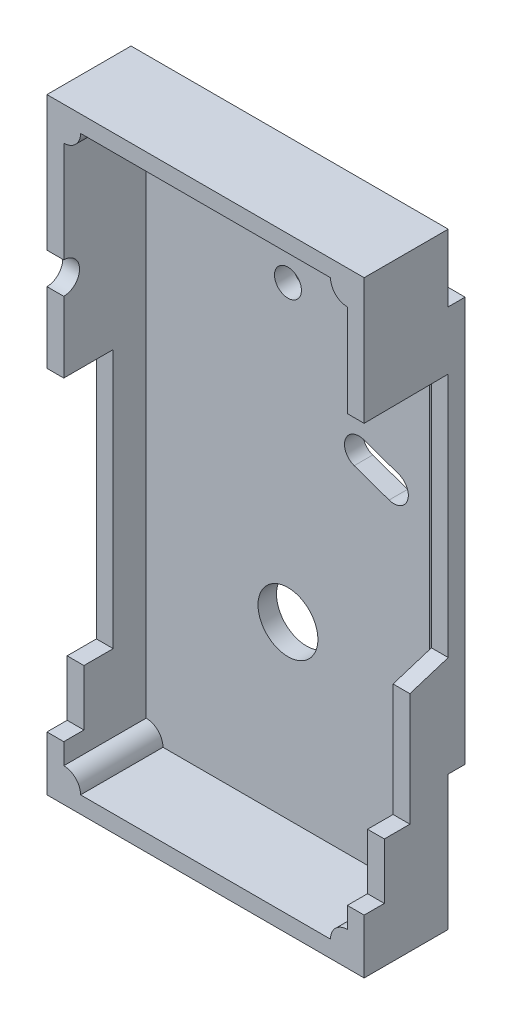
from build123d import *

# Parameters (mm, degrees)
SKETCH2_W                  = 23.9522
SKETCH2_H                  = 45.7962
SKETCH2_R                  = 2.2606
SKETCH2_R_2                = 1.016
BOSS_EXTRUDE1_DEPTH        = 6.35
SKETCH4_W                  = 21.4122
SKETCH4_H                  = 43.2562
CUT_EXTRUDE1_DEPTH         = 6.223
CUT_EXTRUDE3_DEPTH         = 2.54
CUT_EXTRUDE5_DEPTH         = 1.27
BOSS_EXTRUDE3_DEPTH        = 6.223
BOSS_EXTRUDE15_OUTLINE_W   = 23.9522
BOSS_EXTRUDE15_OUTLINE_H   = 30.5562
BOSS_EXTRUDE15_OUTLINE_R   = 2.2606
BOSS_EXTRUDE15_OUTLINE_R_2 = 1.016
BOSS_EXTRUDE15_DEPTH       = 1.27
SKETCH14_R                 = 1.190625
CUT_EXTRUDE6_DEPTH         = 1.27


# Read off the part's stored shape, not the designer's step: Boss-Extrude15
with BuildPart() as part:
    # Sketch2 → Boss-Extrude1 (new body)
    with BuildSketch(Plane.XY):
        Rectangle(SKETCH2_W, SKETCH2_H)
        with Locations((0, -8.7249)):
            Circle(SKETCH2_R, mode=Mode.SUBTRACT)
        with Locations((0, 13.4747)):
            Circle(SKETCH2_R_2, mode=Mode.SUBTRACT)
        with BuildLine():
            Line((8.361518313, 5.139100055), (5.725634689, 6.065681687))
            ThreePointArc((5.725634689, 6.065681687), (4.333034634, 5.3975), (5.001216321, 4.004899945))
            Line((5.001216321, 4.004899945), (7.637099945, 3.078318313))
            ThreePointArc((7.637099945, 3.078318313), (9.0297, 3.7465), (8.361518313, 5.139100055))
        make_face(mode=Mode.SUBTRACT)
    extrude(amount=BOSS_EXTRUDE1_DEPTH)

    # Sketch4 → Cut-Extrude1 (cut)
    with BuildSketch(Plane.XY.offset(6.35)):
        Rectangle(SKETCH4_W, SKETCH4_H)
    extrude(amount=-CUT_EXTRUDE1_DEPTH, mode=Mode.SUBTRACT)

    # Sketch6 → Cut-Extrude3 (cut)
    with BuildSketch(Plane.ZY.offset(11.9761)):
        Polygon((4.826, -14.5669), (2.6162, -14.5669), (2.6162, 4.9911), (6.35, 4.9911), (6.35, -18.7833), (4.826, -18.7833), align=None)
    extrude(amount=-CUT_EXTRUDE3_DEPTH, mode=Mode.SUBTRACT)

    # Sketch8 → Cut-Extrude5 (cut)
    with BuildSketch(Plane(origin=(11.9761, 0, 0), x_dir=(0, 0, -1), z_dir=(1, 0, 0))):
        Polygon((-6.35, -18.7833), (-4.826, -18.7833), (-4.826, -14.5669), (-2.8956, -14.5669), (-2.8956, -6.0325), (0, -5.1181), (0, 13.4239), (-6.35, 13.3731), align=None)
    extrude(amount=-CUT_EXTRUDE5_DEPTH, mode=Mode.SUBTRACT)

    # Sketch10 → Boss-Extrude3 (add)
    with BuildSketch(Plane.XY.offset(0.127)):
        with BuildLine():
            ThreePointArc((-10.7061, 20.3581), (-9.808074388, 20.730074388), (-9.4361, 21.6281))
            Line((-9.4361, 21.6281), (-10.7061, 21.6281))
            Line((-10.7061, 21.6281), (-10.7061, 20.3581))
        make_face()
        with BuildLine():
            ThreePointArc((9.4361, 21.6281), (9.808074388, 20.730074388), (10.7061, 20.3581))
            Line((10.7061, 20.3581), (10.7061, 21.6281))
            Line((10.7061, 21.6281), (9.4361, 21.6281))
        make_face()
        with BuildLine():
            ThreePointArc((-9.4361, -21.6281), (-9.808074388, -20.730074388), (-10.7061, -20.3581))
            Line((-10.7061, -20.3581), (-10.7061, -21.6281))
            Line((-10.7061, -21.6281), (-9.4361, -21.6281))
        make_face()
        with BuildLine():
            Line((10.7061, -21.6281), (10.7061, -20.3581))
            ThreePointArc((10.7061, -20.3581), (9.808074388, -20.730074388), (9.4361, -21.6281))
            Line((9.4361, -21.6281), (10.7061, -21.6281))
        make_face()
    extrude(amount=BOSS_EXTRUDE3_DEPTH)

    # Boss-Extrude15 outline → Boss-Extrude15 (add)
    with BuildSketch(Plane(origin=(0, 0, 0), x_dir=(-1, 0, 0), z_dir=(0, 0, -1))):
        with Locations((0, 2.54)):
            Rectangle(BOSS_EXTRUDE15_OUTLINE_W, BOSS_EXTRUDE15_OUTLINE_H)
        with Locations((0, -8.7249)):
            Circle(BOSS_EXTRUDE15_OUTLINE_R, mode=Mode.SUBTRACT)
        with BuildLine():
            ThreePointArc((-7.637099945, 3.078318313), (-9.0297, 3.7465), (-8.361518313, 5.139100055))
            Line((-8.361518313, 5.139100055), (-5.725634689, 6.065681687))
            ThreePointArc((-5.725634689, 6.065681687), (-4.333034634, 5.3975), (-5.001216321, 4.004899945))
            Line((-5.001216321, 4.004899945), (-7.637099945, 3.078318313))
        make_face(mode=Mode.SUBTRACT)
        with Locations((0, 13.4747)):
            Circle(BOSS_EXTRUDE15_OUTLINE_R_2, mode=Mode.SUBTRACT)
    extrude(amount=BOSS_EXTRUDE15_DEPTH)

    # Sketch14 → Cut-Extrude6 (cut)
    with BuildSketch(Plane.ZY.offset(11.9761)):
        with Locations((6.35, 11.528736377)):
            Circle(SKETCH14_R)
    extrude(amount=-CUT_EXTRUDE6_DEPTH, mode=Mode.SUBTRACT)


solid = part.part
